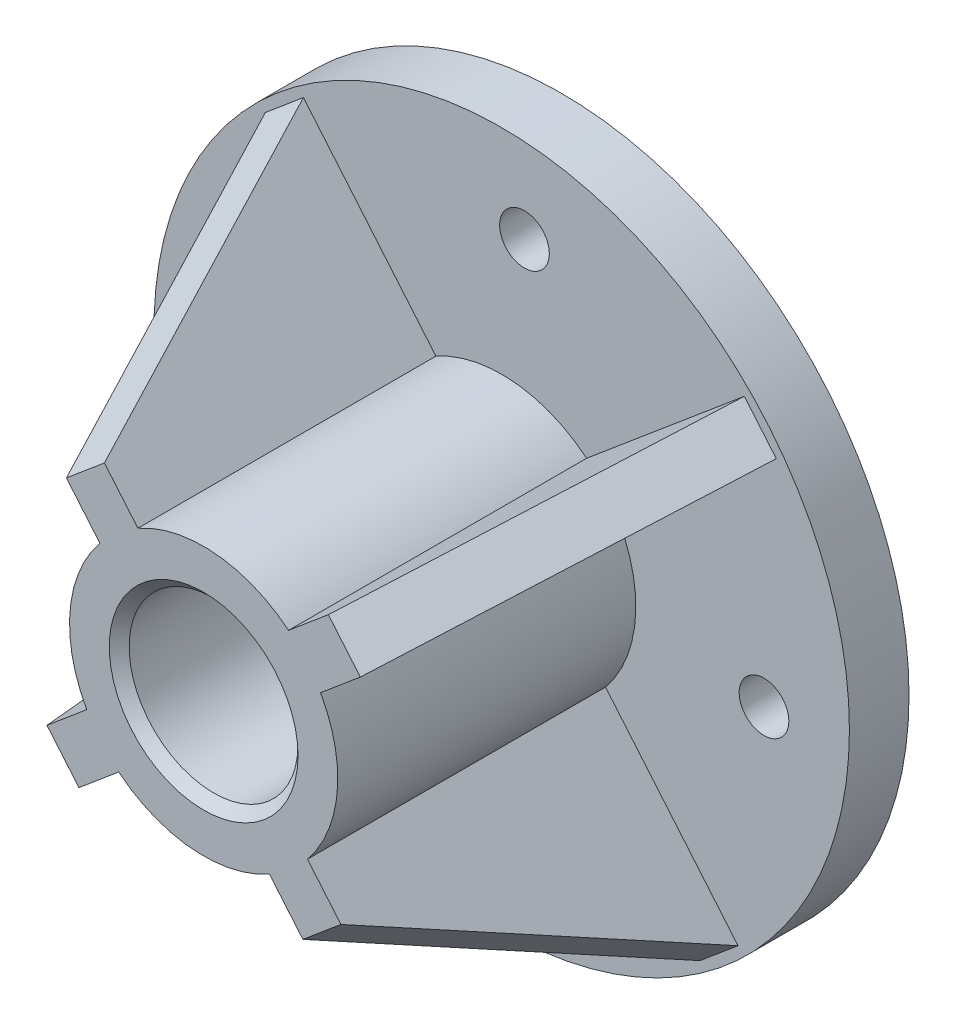
from build123d import *
from OCP.BRepFilletAPI import BRepFilletAPI_MakeChamfer

# Parameters (mm, degrees)
SKETCH1_R                      = 35
BOSS_EXTRUDE1_DEPTH            = 6
SKETCH2_R                      = 13.5
SKETCH2_R_2                    = 8.5
BOSS_EXTRUDE2_DEPTH            = 30
BOSS_EXTRUDE3_DEPTH            = 30
CHAMFER1_SIZE2                 = 30
CHAMFER1_SIZE                  = 15.5
CIRPATTERN2_COUNT              = 4
CHAMFER1_OF_CIRPATTERN2_SIZE   = 15.5
CHAMFER1_OF_CIRPATTERN2_SIZE_2 = 30
CUT_EXTRUDE1_START             = -30
SKETCH4_R                      = 8.5
CUT_EXTRUDE1_DEPTH             = 30
CHAMFER2_SIZE                  = 1
SKETCH5_R                      = 2.5
CUT_EXTRUDE2_DEPTH             = 30
CIRPATTERN3_COUNT              = 4


with BuildPart() as part:
    # Sketch1 → Boss-Extrude1 (new body)
    with BuildSketch(Plane.XY):
        with Locations((-80.451307138, 19.943811433)):
            Circle(SKETCH1_R)
    extrude(amount=BOSS_EXTRUDE1_DEPTH)

    # Sketch2 → Boss-Extrude2 (add)
    with BuildSketch(Plane.XY.offset(6)):
        with Locations((-80.451307138, 19.943811433)):
            Circle(SKETCH2_R)
        with Locations((-80.451307138, 19.943811433)):
            Circle(SKETCH2_R_2, mode=Mode.SUBTRACT)
    extrude(amount=BOSS_EXTRUDE2_DEPTH)

    # Sketch3 → Boss-Extrude3 (add)
    with BuildSketch(Plane.XY.offset(6)):
        Polygon((-75.035425389, 9.612362561), (-71.207426337, 12.828948213), (-56.664525181, -4.478289297), (-60.492524233, -7.694874949), align=None)
    boss_extrude3 = extrude(amount=BOSS_EXTRUDE3_DEPTH)

    # Chamfer1
    chamfer1_edges = [part.edges().sort_by_distance(p)[0] for p in [
        (-58.578524707, -6.086582123, 36),
    ]]
    chamfer1_side = [part.faces().sort_by_distance(p)[0] for p in [
        (-58.777953017, -5.849246182, 36),
    ]]
    chamfer(chamfer1_edges, length=CHAMFER1_SIZE - 0.0001, length2=CHAMFER1_SIZE2 - 0.0001, reference=chamfer1_side[0])  # a hair under: the kernel refuses the full size

    # CirPattern2: Boss-Extrude3 ×4 about axis
    cirpattern2_axis = Axis((-80.451307138, 19.943811433, 0), (0, 0, 1))
    for i in range(1, CIRPATTERN2_COUNT):
        add(boss_extrude3.rotate(cirpattern2_axis, i * 360 / CIRPATTERN2_COUNT))

    # Chamfer1 of CirPattern2
    chamfer1_of_cirpattern2_edges_1 = [part.edges().sort_by_distance(p)[0] for p in [
        (-54.420913581, 41.816593865, 36),
    ]]
    chamfer1_of_cirpattern2_side_1 = [part.faces().sort_by_distance(p)[0] for p in [
        (-54.658249523, 41.617165554, 36),
    ]]
    chamfer1_of_cirpattern2_edges_2 = [part.edges().sort_by_distance(p)[0] for p in [
        (-102.324089569, 45.97420499, 36),
    ]]
    chamfer1_of_cirpattern2_side_2 = [part.faces().sort_by_distance(p)[0] for p in [
        (-102.124661259, 45.736869049, 36),
    ]]
    chamfer1_of_cirpattern2_edges_3 = [part.edges().sort_by_distance(p)[0] for p in [
        (-106.481700695, -1.928970998, 36),
    ]]
    chamfer1_of_cirpattern2_side_3 = [part.faces().sort_by_distance(p)[0] for p in [
        (-106.244364753, -1.729542687, 36),
    ]]
    chamfer1_of_cirpattern2 = BRepFilletAPI_MakeChamfer(part.part.solid().wrapped)
    for e in chamfer1_of_cirpattern2_edges_1:
        chamfer1_of_cirpattern2.Add(CHAMFER1_OF_CIRPATTERN2_SIZE - 0.0001, CHAMFER1_OF_CIRPATTERN2_SIZE_2 - 0.0001, e.wrapped, chamfer1_of_cirpattern2_side_1[0].wrapped)
    for e in chamfer1_of_cirpattern2_edges_2:
        chamfer1_of_cirpattern2.Add(CHAMFER1_OF_CIRPATTERN2_SIZE - 0.0001, CHAMFER1_OF_CIRPATTERN2_SIZE_2 - 0.0001, e.wrapped, chamfer1_of_cirpattern2_side_2[0].wrapped)
    for e in chamfer1_of_cirpattern2_edges_3:
        chamfer1_of_cirpattern2.Add(CHAMFER1_OF_CIRPATTERN2_SIZE - 0.0001, CHAMFER1_OF_CIRPATTERN2_SIZE_2 - 0.0001, e.wrapped, chamfer1_of_cirpattern2_side_3[0].wrapped)
    add(Compound.cast(chamfer1_of_cirpattern2.Shape()), mode=Mode.REPLACE)  # a hair under: the kernel refuses the full size

    # Sketch4 → Cut-Extrude1 (cut)
    with BuildSketch(Plane.XY.offset(6).offset(CUT_EXTRUDE1_START)):
        with Locations((-80.451307138, 19.943811433)):
            Circle(SKETCH4_R)
    extrude(amount=CUT_EXTRUDE1_DEPTH, mode=Mode.SUBTRACT)

    # Chamfer2
    chamfer2_edges = [part.edges().sort_by_distance(p)[0] for p in [
        (-88.951307138, 19.943811433, 36),
    ]]
    chamfer(chamfer2_edges, length=CHAMFER2_SIZE)

    # Sketch5 → Cut-Extrude2 (cut)
    with BuildSketch(Plane.XY.offset(6)):
        with Locations((-106.852057297, 22.235184611)):
            Circle(SKETCH5_R)
    cut_extrude2 = extrude(amount=-CUT_EXTRUDE2_DEPTH, mode=Mode.SUBTRACT)

    # CirPattern3: Cut-Extrude2 ×4 about axis
    cirpattern3_axis = Axis((-80.451307138, 19.943811433, 0), (0, 0, 1))
    for i in range(1, CIRPATTERN3_COUNT):
        add(cut_extrude2.rotate(cirpattern3_axis, i * 360 / CIRPATTERN3_COUNT), mode=Mode.SUBTRACT)


solid = part.part
